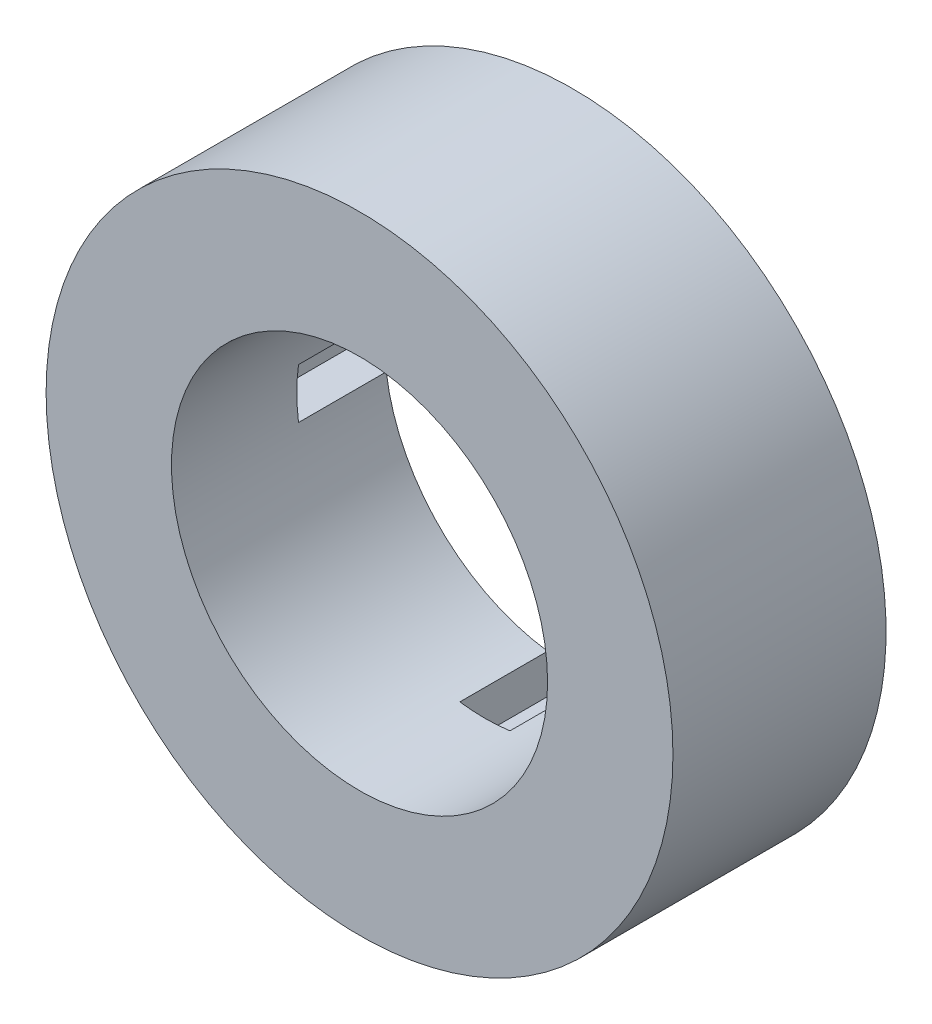
from build123d import *
from build123d.topology import SkipClean

# Parameters (mm, degrees)
SKETCH1_R               = 6.25
SKETCH1_R_2             = 3.75
BOSS_EXTRUDE1_DEPTH     = 5
BOSS_EXTRUDE2_START     = 3
SKETCH2_R               = 5.5
SKETCH2_R_2             = 3.75
BOSS_EXTRUDE2_DEPTH     = 3
THREAD1_PITCH           = 0.6
BOSS_EXTRUDE3_START     = 1.25
SKETCH7_R               = 5
SKETCH7_R_2             = 3.75
BOSS_EXTRUDE3_DEPTH     = 1.25
CUT_EXTRUDE3_DEPTH      = 6.5
CUT_EXTRUDE3_DEPTH_BACK = 5.5
SKETCH5_W               = 1
SKETCH5_H               = 1
BOSS_EXTRUDE4_START     = 0.5
SKETCH8_R               = 5
SKETCH8_R_2             = 3
BOSS_EXTRUDE4_DEPTH     = 0.5
CUT_EXTRUDE4_DEPTH      = 10
CUT_EXTRUDE4_DEPTH_BACK = 10
SKETCH9_W               = 18.419335543
SKETCH9_H               = 5.81075095
SKETCH10_R              = 0.5
CUT_EXTRUDE5_DEPTH      = 2.5
CIRPATTERN1_COUNT       = 4


with BuildPart() as part:
    # Sketch1 → Boss-Extrude1 (new body)
    with BuildSketch(Plane.XY):
        Circle(SKETCH1_R)
        Circle(SKETCH1_R_2, mode=Mode.SUBTRACT)
    extrude(amount=BOSS_EXTRUDE1_DEPTH)

    # Sketch2 → Boss-Extrude2 (add)
    with SkipClean():  # the faces are left unmerged after this step: merging them gives an invalid solid
        with BuildSketch(Plane(origin=(0, 0, 0), x_dir=(-1, 0, 0), z_dir=(0, 0, -1)).offset(BOSS_EXTRUDE2_START)):
            Circle(SKETCH2_R)
            Circle(SKETCH2_R_2, mode=Mode.SUBTRACT)
        extrude(amount=-BOSS_EXTRUDE2_DEPTH)

    # Thread1: the profile of Thread Profile1 profile screwed along a right-hand helix of 6.666667 turns, 6 arcs to a turn; built about Z, then put on its axis
    with SkipClean():  # the faces are left unmerged after this step: merging them gives an invalid solid
        thread1_z = Axis((0, 0, 0), (0, 0, 1))
        thread1_corners = [(5.5003, 0, -0.000173205), (5.5003, 0, 0.525173203), (5.175240475, 0, 0.337499999), (5.175240475, 0, 0.187499999)]
        with BuildLine(mode=Mode.PRIVATE) as thread1_profile:
            Line(thread1_corners[0], thread1_corners[1])
            Line(thread1_corners[1], thread1_corners[2])
            Line(thread1_corners[2], thread1_corners[3])
            Line(thread1_corners[3], thread1_corners[0])
        thread1_cap = Face(thread1_profile.wire())
        thread1_turn_angles = [0, 30, 60, 90, 120, 150, 180, 210, 240, 270, 300, 330, 360]
        thread1_turn_weights = [1, 0.8660254037844387, 1, 0.8660254037844387, 1, 0.8660254037844387, 1, 0.8660254037844387, 1, 0.8660254037844387, 1, 0.8660254037844387, 1]
        thread1_turn_rails = [Edge.make_bspline([Vector(p[0], p[1], 0).rotate(thread1_z, thread1_turn_angles[k]) / thread1_turn_weights[k] + Vector(0, 0, p[2] + THREAD1_PITCH * thread1_turn_angles[k] / 360) for k in range(13)], [0, 0, 0, 1, 1, 2, 2, 3, 3, 4, 4, 5, 5, 6, 6, 6], 2, thread1_turn_weights) for p in thread1_corners]
        thread1_turn_sides = [Face.make_surface_from_curves(thread1_turn_rails[p[0]], thread1_turn_rails[p[1]]) for p in [(0, 1), (1, 2), (2, 3), (3, 0)]]
        thread1_last_angles = [2160, 2190, 2220, 2250, 2280, 2310, 2340, 2370, 2400]
        thread1_last_weights = [1, 0.8660254037844387, 1, 0.8660254037844387, 1, 0.8660254037844387, 1, 0.8660254037844387, 1]
        thread1_last_rails = [Edge.make_bspline([Vector(p[0], p[1], 0).rotate(thread1_z, thread1_last_angles[k]) / thread1_last_weights[k] + Vector(0, 0, p[2] + THREAD1_PITCH * thread1_last_angles[k] / 360) for k in range(9)], [0, 0, 0, 1, 1, 2, 2, 3, 3, 4, 4, 4], 2, thread1_last_weights) for p in thread1_corners]
        thread1_last_sides = [Face.make_surface_from_curves(thread1_last_rails[p[0]], thread1_last_rails[p[1]]) for p in [(0, 1), (1, 2), (2, 3), (3, 0)]]
        thread1 = Plane(origin=(0, 0, -4), x_dir=(1, 0, 0), z_dir=(0, 0, 1)) * Solid(Shell([*[p.moved(Location((0, 0, THREAD1_PITCH * i))) for i in range(6) for p in thread1_turn_sides], *thread1_last_sides, thread1_cap, thread1_cap.rotate(thread1_z, 2400).moved(Location((0, 0, THREAD1_PITCH * 2400 / 360)))]))
        add(thread1, mode=Mode.SUBTRACT)

    # Sketch7 → Boss-Extrude3 (add)
    with SkipClean():  # the faces are left unmerged after this step: merging them gives an invalid solid
        with BuildSketch(Plane(origin=(0, 0, -3), x_dir=(-1, 0, 0), z_dir=(0, 0, -1)).offset(BOSS_EXTRUDE3_START)):
            Circle(SKETCH7_R)
            Circle(SKETCH7_R_2, mode=Mode.SUBTRACT)
        extrude(amount=-BOSS_EXTRUDE3_DEPTH)

    # Sketch5 → Cut-Extrude3 (cut, two sides: drawn at the far end of the back side and taken through both)
    with BuildSketch(Plane(origin=(0, 0, -3), x_dir=(-1, 0, 0), z_dir=(0, 0, -1)).offset(-CUT_EXTRUDE3_DEPTH_BACK)):
        with Locations((4, 0)):
            Rectangle(SKETCH5_W, SKETCH5_H)
        with Locations((0, 4)):
            Rectangle(SKETCH5_W, SKETCH5_H)
        with Locations((0, -4)):
            Rectangle(SKETCH5_W, SKETCH5_H)
        with Locations((-4, 0)):
            Rectangle(SKETCH5_W, SKETCH5_H)
    extrude(amount=CUT_EXTRUDE3_DEPTH + CUT_EXTRUDE3_DEPTH_BACK, mode=Mode.SUBTRACT)

    # Sketch8 → Boss-Extrude4 (add)
    with BuildSketch(Plane(origin=(0, 0, -4.25), x_dir=(-1, 0, 0), z_dir=(0, 0, -1)).offset(BOSS_EXTRUDE4_START)):
        Circle(SKETCH8_R)
        Circle(SKETCH8_R_2, mode=Mode.SUBTRACT)
    extrude(amount=-BOSS_EXTRUDE4_DEPTH)

    # Sketch9 → Cut-Extrude4 (cut, two sides: drawn at the far end of the back side and taken through both)
    with BuildSketch(Plane(origin=(0, 0, 0), x_dir=(1, 0, 0), z_dir=(0, 1, 0)).offset(-CUT_EXTRUDE4_DEPTH_BACK)):
        with Locations((-0.0093121, 2.155375475)):
            Rectangle(SKETCH9_W, SKETCH9_H)
    extrude(amount=CUT_EXTRUDE4_DEPTH + CUT_EXTRUDE4_DEPTH_BACK, mode=Mode.SUBTRACT)

    # Sketch10 → Cut-Extrude5 (cut)
    with BuildSketch(Plane(origin=(0, 0, 0.75), x_dir=(-1, 0, 0), z_dir=(0, 0, -1))):
        with Locations((-3.535533906, 3.535533906)):
            Circle(SKETCH10_R)
    cut_extrude5 = extrude(amount=-CUT_EXTRUDE5_DEPTH, mode=Mode.SUBTRACT)

    # CirPattern1: Cut-Extrude5 ×4 about axis
    cirpattern1_axis = Axis((0, 0, 0), (0, 0, 1))
    for i in range(1, CIRPATTERN1_COUNT):
        add(cut_extrude5.rotate(cirpattern1_axis, i * 360 / CIRPATTERN1_COUNT), mode=Mode.SUBTRACT)


solid = part.part
